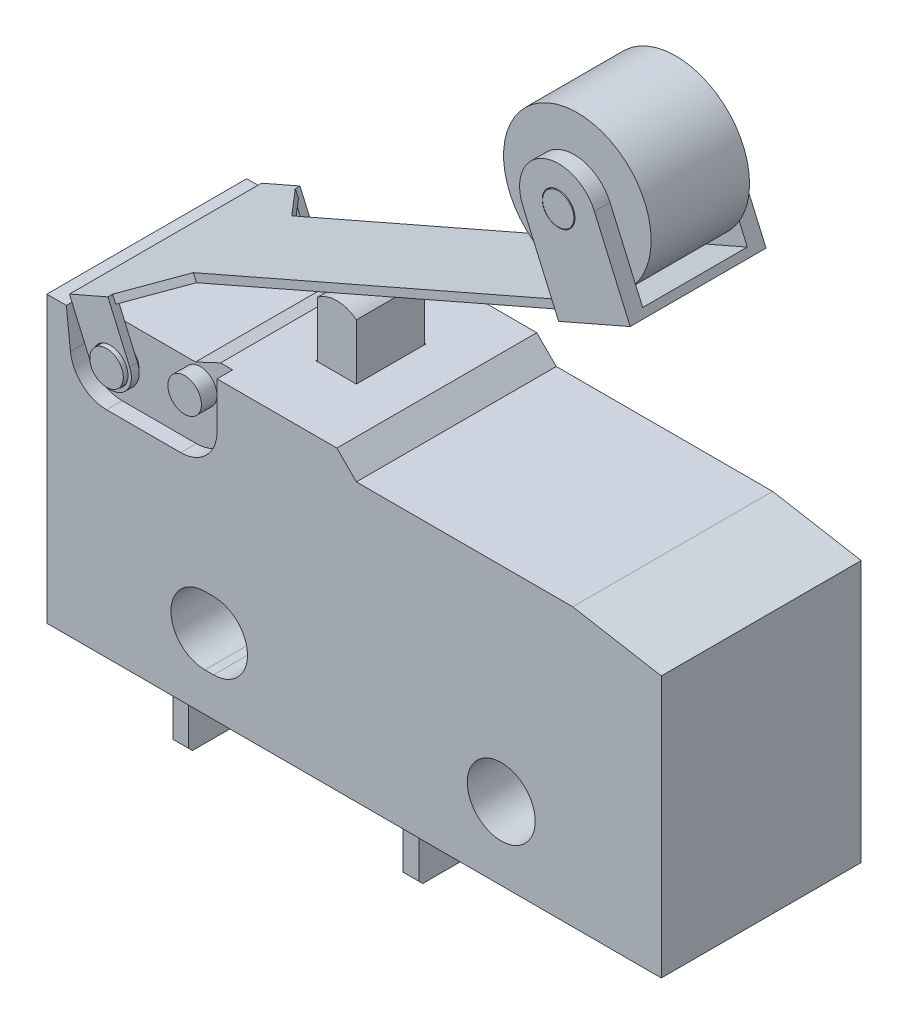
from build123d import *

# Parameters (mm, degrees)
SKETCH2_R            = 1.1049
EXTRUDE1_DEPTH       = 3.2512
EXTRUDE2_DEPTH       = 1.1049
SKETCH4_W            = 1.3208
SKETCH4_H            = 2.2606
CUT_EXTRUDE1_DEPTH   = 1.016
SKETCH5_R            = 0.5461
CUT_EXTRUDE2_DEPTH   = 0.508
SKETCH10_R           = 0.9017
EXTRUDE6_DEPTH       = 0.254
LPATTERN1_COUNT      = 2
LPATTERN1_PITCH      = 7.493
EXTRUDE3_DEPTH       = 1.6002
EXTRUDE4_START       = -0.127
SKETCH8_R            = 0.5715
EXTRUDE4_DEPTH       = 0.254
EXTRUDE5_DEPTH       = 1.27
SKETCH11_R           = 2.4003
EXTRUDE7_DEPTH       = 1.6002
SKETCH12_R           = 0.508
EXTRUDE8_DEPTH       = 2.2225
EXTRUDE9_START       = 0.1016
SKETCH13_R           = 0.5334
EXTRUDE9_DEPTH       = 0.508
EXTRUDE10_DEPTH      = 2.2098
EXTRUDE10_DEPTH_BACK = 2.2098


with BuildPart() as part:
    # Sketch2 → Extrude1 (new, symmetric)
    with BuildSketch(Plane.XY):
        Polygon((9.9949, 8.509), (7.113888836, 9.017), (0.0762, 9.017), (-0.5588, 9.652), (-4.8514, 9.652), (-5.664596778, 9.271), (-9.9949, 9.271), (-9.9949, 0), (9.9949, 0), align=None)
        with Locations((4.7879, 2.3622)):
            Circle(SKETCH2_R, mode=Mode.SUBTRACT)
        with BuildLine():
            Line((-4.8514, 3.4671), (-4.572, 3.4671))
            ThreePointArc((-4.572, 3.4671), (-3.4671, 2.3622), (-4.572, 1.2573))
            Line((-4.572, 1.2573), (-4.8514, 1.2573))
            ThreePointArc((-4.8514, 1.2573), (-5.9563, 2.3622), (-4.8514, 3.4671))
        make_face(mode=Mode.SUBTRACT)
    extrude(amount=EXTRUDE1_DEPTH, both=True)

    # Sketch4 → Cut-Extrude1 (cut)
    with BuildSketch(Plane(origin=(0, 9.652, 0), x_dir=(-1, 0, 0), z_dir=(0, 1, 0))):
        with Locations((2.7051, 0)):
            Rectangle(SKETCH4_W, SKETCH4_H)
    extrude(amount=-CUT_EXTRUDE1_DEPTH, mode=Mode.SUBTRACT)

    # Sketch5 → Cut-Extrude2 (cut)
    with BuildSketch(Plane.XY.offset(3.2512)):
        with BuildLine():
            Line((-8.0518, 6.985), (-5.6388, 6.985))
            ThreePointArc((-5.6388, 6.985), (-4.803636181, 7.330936181), (-4.4577, 8.1661))
            Line((-4.4577, 8.1661), (-4.4577, 9.652))
            Line((-4.4577, 9.652), (-4.8514, 9.652))
            Line((-4.8514, 9.652), (-5.664596778, 9.271))
            Line((-5.664596778, 9.271), (-9.2329, 9.271))
            Line((-9.2329, 9.271), (-9.3599, 9.271))
            Line((-9.3599, 9.271), (-9.225989606, 8.038522651))
            ThreePointArc((-9.225989606, 8.038522651), (-8.840569803, 7.286987147), (-8.0518, 6.985))
        make_face()
        with Locations((-5.5118, 8.6741)):
            Circle(SKETCH5_R, mode=Mode.SUBTRACT)
        with Locations((-8.0518, 8.1661)):
            Circle(SKETCH5_R, mode=Mode.SUBTRACT)
    cut_extrude2 = extrude(amount=-CUT_EXTRUDE2_DEPTH, mode=Mode.SUBTRACT)

    # Mirror1: Cut-Extrude2 across plane
    add(cut_extrude2.mirror(Plane.XY), mode=Mode.SUBTRACT)

    # Sketch10 → Extrude6 (add, symmetric)
    with BuildSketch(Plane(origin=(-7.493, 0, 0), x_dir=(0, 0, -1), z_dir=(1, 0, 0))):
        Polygon((-1.397, 0), (-1.397, -3.0734), (-1.27, -3.2004), (1.27, -3.2004), (1.397, -3.0734), (1.397, 0), align=None)
        with Locations((0, -1.7018)):
            Circle(SKETCH10_R, mode=Mode.SUBTRACT)
    extrude6 = extrude(amount=EXTRUDE6_DEPTH, both=True)

    # LPattern1: Extrude6 ×2
    with Locations(*[(i * LPATTERN1_PITCH, 0, 0) for i in range(1, LPATTERN1_COUNT)]):
        add(extrude6)


with BuildPart() as body_2:
    # Sketch3 → Extrude2 (new, symmetric)
    with BuildSketch(Plane.XY):
        with BuildLine():
            Line((-3.3401, 9.271), (-3.3401, 11.435714746))
            ThreePointArc((-3.3401, 11.435714746), (-2.7051, 11.6586), (-2.0701, 11.435714746))
            Line((-2.0701, 11.435714746), (-2.0701, 9.271))
            Line((-2.0701, 9.271), (-3.3401, 9.271))
        make_face()
    extrude(amount=EXTRUDE2_DEPTH, both=True)


with BuildPart() as body_3:
    # Sketch6 → Extrude3 (new, symmetric)
    with BuildSketch(Plane.XY):
        Polygon((-9.2837, 9.281466924), (7.941234618, 16.804182087), (7.839576305, 17.036951474), (-9.385358313, 9.514236311), align=None)
    extrude(amount=EXTRUDE3_DEPTH, both=True)


with BuildPart() as body_4:
    # Sketch8 → Extrude4 (new body)
    with BuildSketch(Plane.XY.offset(3.2512).offset(EXTRUDE4_START)):
        with BuildLine():
            Line((-7.426320532, 8.439268171), (-8.134399377, 10.060572652))
            Line((-8.134399377, 10.060572652), (-9.385358313, 9.514236311))
            Line((-9.385358313, 9.514236311), (-8.677279468, 7.892931829))
            ThreePointArc((-8.677279468, 7.892931829), (-7.778631829, 7.540620532), (-7.426320532, 8.439268171))
        make_face()
        with Locations((-8.0518, 8.1661)):
            Circle(SKETCH8_R, mode=Mode.SUBTRACT)
    extrude(amount=-EXTRUDE4_DEPTH)

    # Sketch9 → Extrude5 (add)
    with BuildSketch(Plane.XY.offset(1.6002)):
        Polygon((-8.032741064, 9.827803266), (-8.134399377, 10.060572652), (-9.385358313, 9.514236311), (-9.2837, 9.281466924), align=None)
    extrude(amount=EXTRUDE5_DEPTH)


with BuildPart() as body_5:
    # Mirror7: mirrored copy
    add(body_4.part.mirror(Plane.XY))

    # Combine1: union body 3, body 4
    add(body_3.part)
    add(body_4.part)



with BuildPart() as body_4_2:
    # Sketch11 → Extrude7 (new, symmetric)
    with BuildSketch(Plane.XY):
        with Locations((5.6134, 18.9611)):
            Circle(SKETCH11_R)
    extrude(amount=EXTRUDE7_DEPTH, both=True)

    # Sketch12 → Extrude8 (add, symmetric)
    with BuildSketch(Plane.XY):
        with Locations((5.6134, 18.9611)):
            Circle(SKETCH12_R)
    extrude(amount=EXTRUDE8_DEPTH, both=True)


with BuildPart() as body_5_2:
    # Sketch13 → Extrude9 (new body)
    with BuildSketch(Plane.XY.offset(1.6002).offset(EXTRUDE9_START)):
        with BuildLine():
            Line((5.61354075, 15.787598957), (7.941234618, 16.804182087))
            Line((7.941234618, 16.804182087), (6.777246934, 19.469391565))
            ThreePointArc((6.777246934, 19.469391565), (5.105108435, 20.124946934), (4.449553066, 18.452808435))
            Line((4.449553066, 18.452808435), (5.61354075, 15.787598957))
        make_face()
        with Locations((5.6134, 18.9611)):
            Circle(SKETCH13_R, mode=Mode.SUBTRACT)
    extrude(amount=EXTRUDE9_DEPTH)


with BuildPart() as body_6:
    # Mirror8: mirrored copy
    add(body_5_2.part.mirror(Plane.XY))


with BuildPart() as body_5_1:
    add(body_5.part)

    add(body_5_2.part)  # Extrude10 merges body 5 2

    add(body_6.part)  # Extrude10 merges body 6
    # Sketch14 → Extrude10 (add, two sides: drawn at the far end of the back side and taken through both)
    with BuildSketch(Plane.XY.offset(-EXTRUDE10_DEPTH_BACK)):
        Polygon((5.61354075, 15.787598957), (5.511882437, 16.020368344), (7.839576305, 17.036951474), (7.941234618, 16.804182087), align=None)
    extrude(amount=EXTRUDE10_DEPTH + EXTRUDE10_DEPTH_BACK)

    # Chamfer1
    # the kernel refuses this chamfer: 1.3716 mm, written as the material it adds along each edge
    with BuildSketch(Plane(origin=(-8.032741064, 9.827803266, -1.6002), x_dir=(0.9160684273836894, 0.4000782587446979, 0.027495876610586355), z_dir=(-0.4002295787800335, 0.9164149083627771, 0)), Plane(origin=(-8.032741064, 9.827803266, 1.6002), x_dir=(-0.02519763124444392, -0.011004663114042402, 0.9996219169112968), z_dir=(-0.4002295787800335, 0.9164149083627771, 0))) as chamfer1_piece_1:
        with BuildLine():
            Line((1.410928155, 0), (-0.077560078, 1.408794766))
            Line((-0.077560078, 1.408794766), (-0.104981706, 1.408040499))
            ThreePointArc((-0.104981706, 1.408040499), (-0.046811648, 0.704176463), (-0.027421628, -0.000754267))
            Line((-0.027421628, -0.000754267), (0.000754267, -0.027421628))
            ThreePointArc((0.000754267, -0.027421628), (0.705684997, -0.008031609), (1.411682421, -0.027421628))
            Line((1.411682421, -0.027421628), (1.410928155, 0))
        make_face()
    extrude(amount=0.254)


solid = Compound([part.part, body_2.part, body_4_2.part, body_5_1.part])
